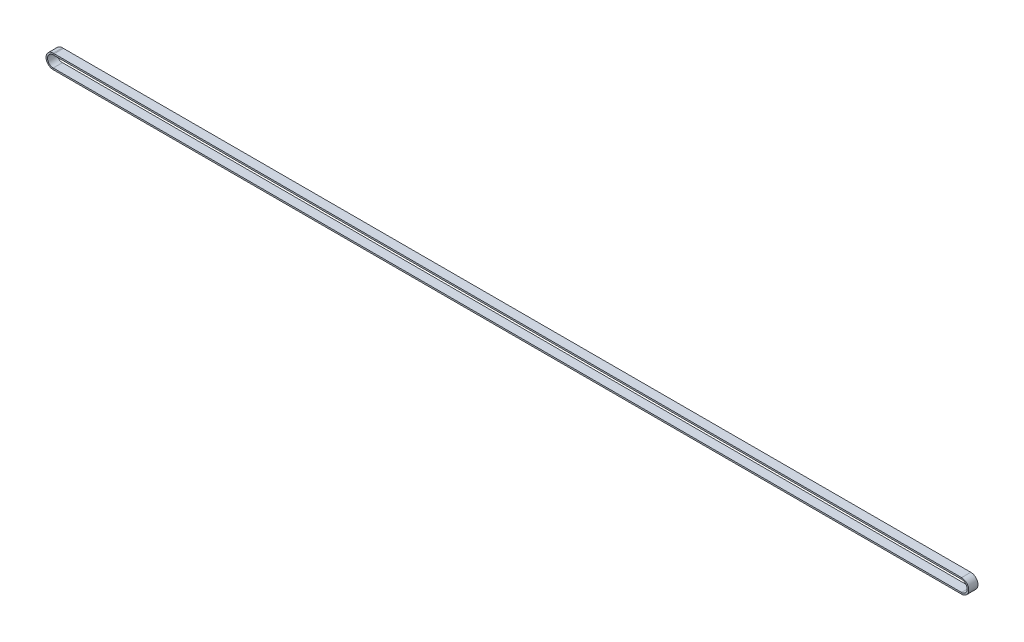
from build123d import *

# Parameters (mm, degrees)
SKETCH3_W = 9
SKETCH3_H = 1.5


with BuildPart() as part:
    # Sweep1: sweep along a path in Sketch2
    with BuildLine(Plane.XY) as sweep1_path:
        Line((-1, -26.7899768), (883.52063792, -26.7899768))
        ThreePointArc((883.52063792, -26.7899768), (890.52063792, -33.7899768), (883.52063792, -40.7899768))
        Line((883.52063792, -40.7899768), (-1, -40.7899768))
        ThreePointArc((-1, -40.7899768), (-8, -33.7899768), (-1, -26.7899768))
    # Sketch3 → Sweep1 (sweep)
    with BuildSketch(Plane(origin=(0, 0, 0), x_dir=(0, 0, -1), z_dir=(1, 0, 0))):
        with Locations((-4.5, -27.5399768)):
            Rectangle(SKETCH3_W, SKETCH3_H)
    sweep(path=sweep1_path.line)


solid = part.part
